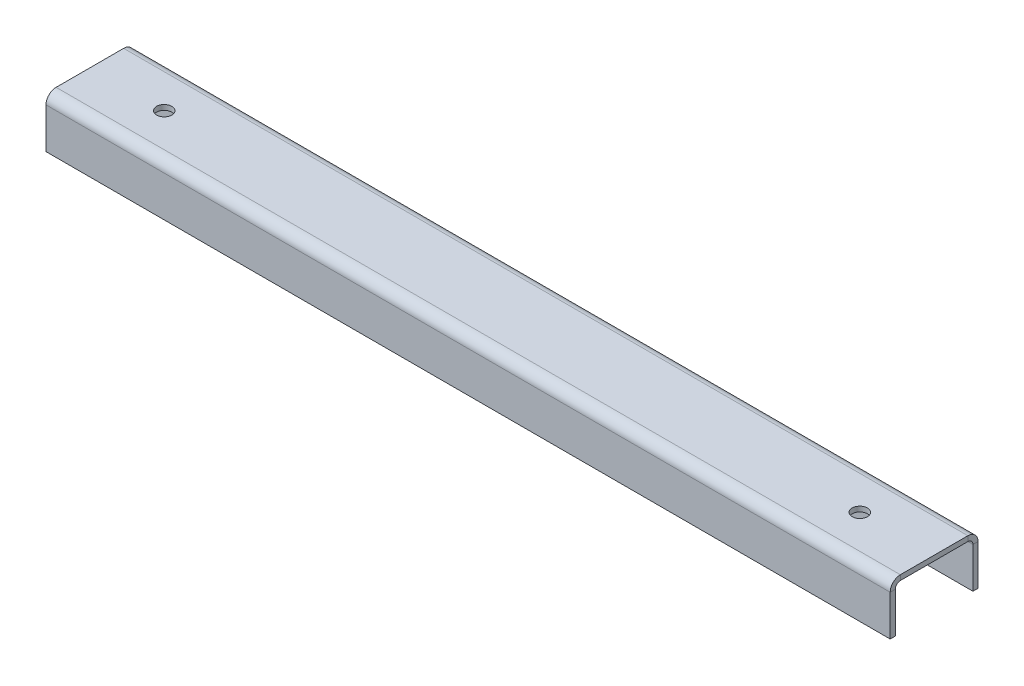
from build123d import *

# Parameters (mm, degrees)
SKETCH1_W               = 500
SKETCH1_H               = 40
SKETCH1_R               = 4.5
BASE_FLANGE1_DEPTH      = 3
EDGE_FLANGE1_DEPTH      = 500
EDGE_FLANGE1_BEND_DEPTH = 500


# Sheet-metal steps are written as plain solids
with BuildPart() as part:
    # Sketch1 → Base-Flange1 (new body)
    with BuildSketch(Plane(origin=(1355.32335997, -102522.563627841, -30605.108385113), x_dir=(1, 0, 0), z_dir=(0, 1, 0))):
        with Locations((0.368301387, -1705.033559341)):
            Rectangle(SKETCH1_W, SKETCH1_H)
        with Locations(Location((-205.631698613, -1705.033559341, 0), (0, 0, 270))):
            Circle(SKETCH1_R, mode=Mode.SUBTRACT)
        with Locations(Location((206.368301387, -1705.033559341, 0), (0, 0, 270))):
            Circle(SKETCH1_R, mode=Mode.SUBTRACT)
    extrude(amount=-BASE_FLANGE1_DEPTH)

    # Edge-Flange1 section (across the edge) → Edge-Flange1 (add)
    with BuildSketch(Plane(origin=(1605.691661356, -102525.563627841, -28877.074825771), x_dir=(0, 0, -1), z_dir=(-1, 0, 0))):
        with BuildLine():
            Line((-3, 3), (-3, 27))
            Line((-3, 27), (0, 27))
            Line((0, 27), (0, 3))
            ThreePointArc((0, 3), (0.878679656, 0.878679656), (3, 0))
            Line((3, 0), (3, -3))
            ThreePointArc((3, -3), (-1.242640687, -1.242640687), (-3, 3))
        make_face()
    extrude(amount=EDGE_FLANGE1_DEPTH)

    # Edge-Flange1 section 2 (across the edge) → Edge-Flange1 bend (add)
    with BuildSketch(Plane(origin=(1105.691661356, -102525.563627841, -28923.074825771), x_dir=(0, 0, 1), z_dir=(1, 0, 0))):
        with BuildLine():
            Line((-3, 3), (-3, 27))
            Line((-3, 27), (0, 27))
            Line((0, 27), (0, 3))
            ThreePointArc((0, 3), (0.878679656, 0.878679656), (3, 0))
            Line((3, 0), (3, -3))
            ThreePointArc((3, -3), (-1.242640687, -1.242640687), (-3, 3))
        make_face()
    extrude(amount=EDGE_FLANGE1_BEND_DEPTH)


solid = part.part
